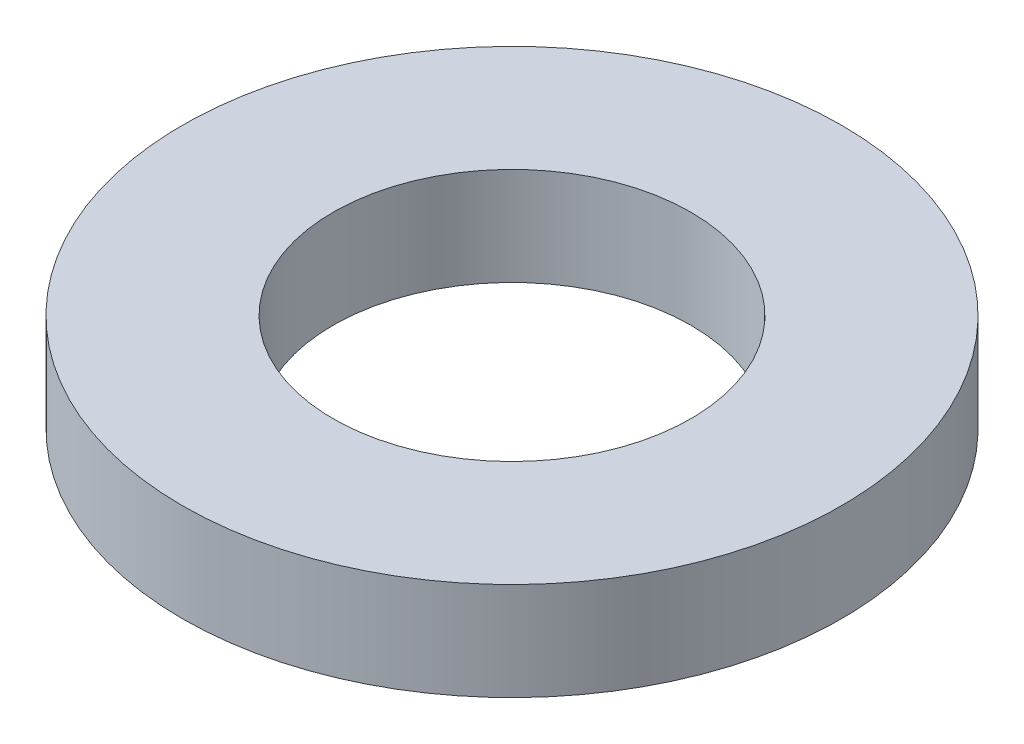
from build123d import *

# Parameters (mm, degrees)
SKETCH1_R           = 87.5
BOSS_EXTRUDE1_DEPTH = 26
SKETCH2_R           = 47.5
CUT_EXTRUDE1_DEPTH  = 127.445640494


with BuildPart() as part:
    # Sketch1 → Boss-Extrude1 (new body)
    with BuildSketch(Plane(origin=(0, 0, 0), x_dir=(1, 0, 0), z_dir=(0, 1, 0))):
        Circle(SKETCH1_R)
    extrude(amount=BOSS_EXTRUDE1_DEPTH)

    # Sketch2 → Cut-Extrude1 (cut, through all)
    with BuildSketch(Plane(origin=(0, 0, 0), x_dir=(1, 0, 0), z_dir=(0, 1, 0))):
        Circle(SKETCH2_R)
    extrude(amount=CUT_EXTRUDE1_DEPTH, mode=Mode.SUBTRACT)


solid = part.part
